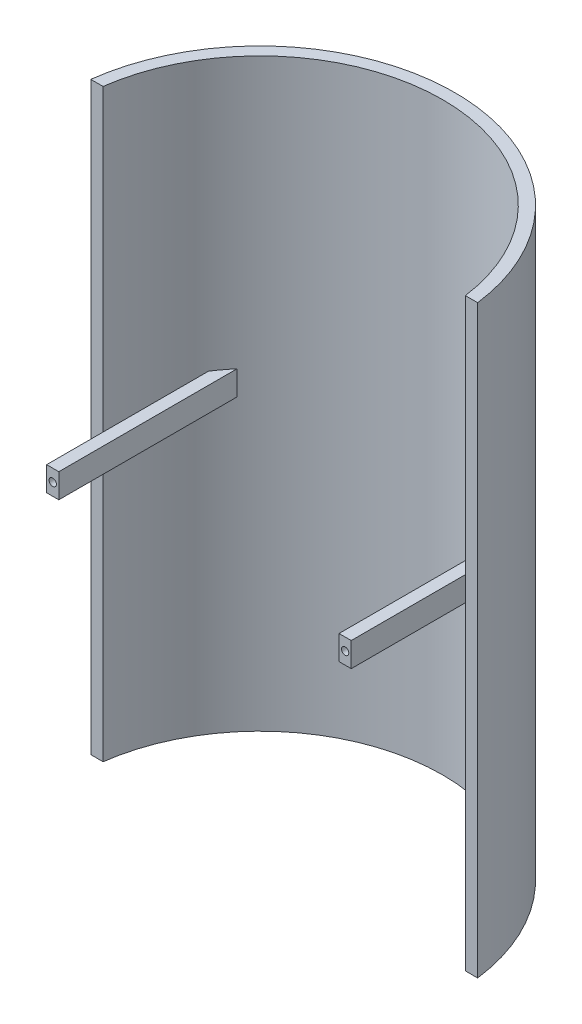
from build123d import *

# Parameters (mm, degrees)
Y_KSEKLIK_EKSTR_ZYON1_DEPTH = 70
KES_EKSTR_ZYON11_DEPTH      = 242
IZIM3_W                     = 100
IZIM3_H                     = 10
Y_KSEKLIK_EKSTR_ZYON4_DEPTH = 2.5
KES_EKSTR_ZYON12_REACH      = 177.214
KES_EKSTR_ZYON12_END_RADIUS = 80
IZIM13_W                    = 5
IZIM13_H                    = 10
IZIM14_R                    = 1.5
KES_EKSTR_ZYON13_DEPTH      = 27


with BuildPart() as part:
    # Çizim1 → Yükseklik-Ekstrüzyon1 (new body)
    with BuildSketch(Plane.XY):
        with BuildLine():
            Line((-80, 120), (80, 120))
            ThreePointArc((80, 120), (87.071067812, 117.071067812), (90, 110))
            Line((90, 110), (90, -110))
            ThreePointArc((90, -110), (87.071067812, -117.071067812), (80, -120))
            Line((80, -120), (-80, -120))
            ThreePointArc((-80, -120), (-87.071067812, -117.071067812), (-90, -110))
            Line((-90, -110), (-90, 110))
            ThreePointArc((-90, 110), (-87.071067812, 117.071067812), (-80, 120))
        make_face()
    extrude(amount=Y_KSEKLIK_EKSTR_ZYON1_DEPTH)

    # Çizim12 → Kes-Ekstrüzyon11 (cut)
    with BuildSketch(Plane(origin=(0, 120, 0), x_dir=(1, 0, 0), z_dir=(0, 1, 0))):
        with BuildLine():
            Line((90, -70), (90, 0))
            Line((90, 0), (2.06e-07, 0))
            ThreePointArc((2.06e-07, 0), (52.915026299, -20.000000068), (79.372539332, -70))
            Line((79.372539332, -70), (90, -70))
        make_face()
        with BuildLine():
            ThreePointArc((-79.372539332, -70), (-52.915026144, -19.999999932), (2.06e-07, 0))
            Line((2.06e-07, 0), (-90, 0))
            Line((-90, 0), (-90, -70))
            Line((-90, -70), (-79.372539332, -70))
        make_face()
        with BuildLine():
            Line((-74.330343737, -70), (74.330343737, -70))
            ThreePointArc((74.330343737, -70), (0, -5), (-74.330343737, -70))
        make_face()
    extrude(amount=-KES_EKSTR_ZYON11_DEPTH, mode=Mode.SUBTRACT)

    # Çizim3 → Yükseklik-Ekstrüzyon4 (add, symmetric)
    with BuildSketch(Plane(origin=(-60, 0, 0), x_dir=(0, 0, -1), z_dir=(1, 0, 0))):
        with Locations((-55, 4)):
            Rectangle(IZIM3_W, IZIM3_H)
    y_kseklik_ekstr_zyon4 = extrude(amount=Y_KSEKLIK_EKSTR_ZYON4_DEPTH, both=True)

    # Kes-Ekstrüzyon12: up to this cylinder (the profile starts outside it)
    kes_ekstr_zyon12_end = Plane(origin=(0, 4, 80), z_dir=(0, 1, 0)) * Cylinder(KES_EKSTR_ZYON12_END_RADIUS, 515.428, mode=Mode.PRIVATE)
    # Çizim13 → Kes-Ekstrüzyon12 (cut, up to the surface)
    with BuildSketch(Plane(origin=(0, 0, 5), x_dir=(-1, 0, 0), z_dir=(0, 0, -1)), mode=Mode.PRIVATE) as kes_ekstr_zyon12_sk1:
        with Locations((60, 4)):
            Rectangle(IZIM13_W, IZIM13_H)
    kes_ekstr_zyon12_tool1 = extrude(kes_ekstr_zyon12_sk1.sketch, amount=-KES_EKSTR_ZYON12_REACH, mode=Mode.PRIVATE) - kes_ekstr_zyon12_end
    kes_ekstr_zyon12 = kes_ekstr_zyon12_tool1.solids().sort_by_distance((-60, 4, 5))[0]
    add(kes_ekstr_zyon12, mode=Mode.SUBTRACT)

    # Çizim14 → Kes-Ekstrüzyon13 (cut)
    with BuildSketch(Plane.XY.offset(105)):
        with Locations((-60, 4)):
            Circle(IZIM14_R)
    kes_ekstr_zyon13 = extrude(amount=-KES_EKSTR_ZYON13_DEPTH, mode=Mode.SUBTRACT)

    # Aynalama4: Yükseklik-Ekstrüzyon4, Kes-Ekstrüzyon12, Kes-Ekstrüzyon13 across plane
    add(y_kseklik_ekstr_zyon4.mirror(Plane(origin=(0, 0, 0), x_dir=(0, 0, 1), z_dir=(1, 0, 0))))
    add(kes_ekstr_zyon12.mirror(Plane(origin=(0, 0, 0), x_dir=(0, 0, 1), z_dir=(1, 0, 0))), mode=Mode.SUBTRACT)
    add(kes_ekstr_zyon13.mirror(Plane(origin=(0, 0, 0), x_dir=(0, 0, 1), z_dir=(1, 0, 0))), mode=Mode.SUBTRACT)


solid = part.part
